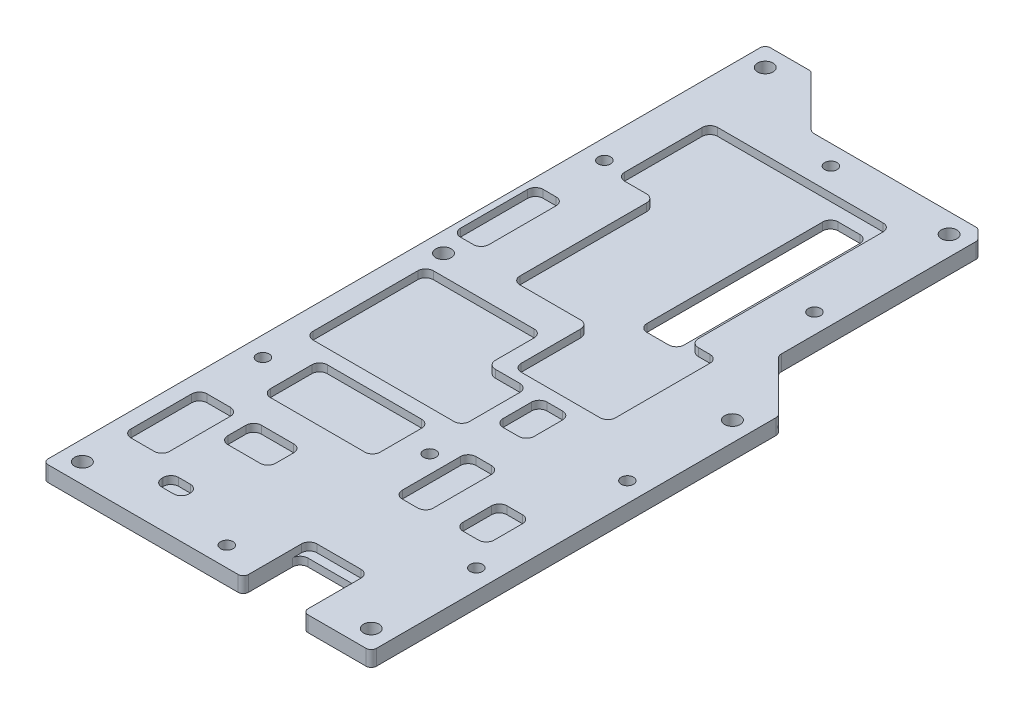
from build123d import *

# Parameters (mm, degrees)
BOSS_EXTRUDE1_DEPTH                                  = 3
CUT_EXTRUDE1_DEPTH                                   = 1.5
CUT_EXTRUDE2_REACH                                   = 155.484
F_3_0MM_DOWEL_HOLE1_D                                = 3
CSK_FOR_M2_COUNTERSUNK_RAISED_HEAD_SCREW_D           = 2.4
CSK_FOR_M2_COUNTERSUNK_RAISED_HEAD_SCREW_CSINK_D     = 4.4
CSK_FOR_M2_COUNTERSUNK_RAISED_HEAD_SCREW_CSINK_ANGLE = 90


with BuildPart() as part:
    # Sketch1 → Boss-Extrude1 (new body)
    with BuildSketch(Plane(origin=(0, 0, 0), x_dir=(1, 0, 0), z_dir=(0, 1, 0))):
        with BuildLine():
            Line((0, 1), (0, 138.7))
            ThreePointArc((0, 138.7), (0.292893219, 139.407106781), (1, 139.7))
            Line((1, 139.7), (8.475786438, 139.7))
            ThreePointArc((8.475786438, 139.7), (8.85846987, 139.623879533), (9.182893219, 139.407106781))
            Line((9.182893219, 139.407106781), (18.610660172, 129.979339828))
            ThreePointArc((18.610660172, 129.979339828), (19.097295195, 129.654180701), (19.671320344, 129.54))
            Line((19.671320344, 129.54), (50.895786438, 129.54))
            ThreePointArc((50.895786438, 129.54), (51.27846987, 129.463879533), (51.602893219, 129.247106781))
            Line((51.602893219, 129.247106781), (53.047106781, 127.802893219))
            ThreePointArc((53.047106781, 127.802893219), (53.263879533, 127.47846987), (53.34, 127.095786438))
            Line((53.34, 127.095786438), (53.34, 89.521320344))
            ThreePointArc((53.34, 89.521320344), (53.454180701, 88.947295195), (53.779339828, 88.460660172))
            Line((53.779339828, 88.460660172), (63.207106781, 79.032893219))
            ThreePointArc((63.207106781, 79.032893219), (63.423879533, 78.70846987), (63.5, 78.325786438))
            Line((63.5, 78.325786438), (63.5, 1))
            ThreePointArc((63.5, 1), (63.207106781, 0.292893219), (62.5, 0))
            Line((62.5, 0), (51.25, 0))
            ThreePointArc((51.25, 0), (50.542893219, 0.292893219), (50.25, 1))
            Line((50.25, 1), (50.25, 9.5))
            ThreePointArc((50.25, 9.5), (49.810660172, 10.560660172), (48.75, 11))
            Line((48.75, 11), (40.25, 11))
            ThreePointArc((40.25, 11), (39.189339828, 10.560660172), (38.75, 9.5))
            Line((38.75, 9.5), (38.75, 1))
            ThreePointArc((38.75, 1), (38.457106781, 0.292893219), (37.75, 0))
            Line((37.75, 0), (1, 0))
            ThreePointArc((1, 0), (0.292893219, 0.292893219), (0, 1))
        make_face()
    extrude(amount=BOSS_EXTRUDE1_DEPTH)

    # Sketch2 → Cut-Extrude1 (cut)
    with BuildSketch(Plane(origin=(0, 3, 0), x_dir=(1, 0, 0), z_dir=(0, 1, 0))):
        with BuildLine():
            Line((50.25, 0), (50.25, 11.25))
            ThreePointArc((50.25, 11.25), (49.810660172, 12.310660172), (48.75, 12.75))
            Line((48.75, 12.75), (40.25, 12.75))
            ThreePointArc((40.25, 12.75), (39.189339828, 12.310660172), (38.75, 11.25))
            Line((38.75, 11.25), (38.75, 0))
            Line((38.75, 0), (50.25, 0))
        make_face()
        with BuildLine():
            Line((52.25, 37.5), (55.25, 37.5))
            ThreePointArc((55.25, 37.5), (56.310660172, 37.060660172), (56.75, 36))
            Line((56.75, 36), (56.75, 30.5))
            ThreePointArc((56.75, 30.5), (56.310660172, 29.439339828), (55.25, 29))
            Line((55.25, 29), (52.25, 29))
            ThreePointArc((52.25, 29), (51.189339828, 29.439339828), (50.75, 30.5))
            Line((50.75, 30.5), (50.75, 36))
            ThreePointArc((50.75, 36), (51.189339828, 37.060660172), (52.25, 37.5))
        make_face()
        with BuildLine():
            Line((41, 42.75), (44, 42.75))
            ThreePointArc((44, 42.75), (45.060660172, 42.310660172), (45.5, 41.25))
            Line((45.5, 41.25), (45.5, 30))
            ThreePointArc((45.5, 30), (45.060660172, 28.939339828), (44, 28.5))
            Line((44, 28.5), (41, 28.5))
            ThreePointArc((41, 28.5), (39.939339828, 28.939339828), (39.5, 30))
            Line((39.5, 30), (39.5, 41.25))
            ThreePointArc((39.5, 41.25), (39.939339828, 42.310660172), (41, 42.75))
        make_face()
        with BuildLine():
            Line((11.25, 43.75), (29.5, 43.75))
            ThreePointArc((29.5, 43.75), (30.560660172, 43.310660172), (31, 42.25))
            Line((31, 42.25), (31, 34.25))
            ThreePointArc((31, 34.25), (30.560660172, 33.189339828), (29.5, 32.75))
            Line((29.5, 32.75), (11.25, 32.75))
            ThreePointArc((11.25, 32.75), (10.189339828, 33.189339828), (9.75, 34.25))
            Line((9.75, 34.25), (9.75, 42.25))
            ThreePointArc((9.75, 42.25), (10.189339828, 43.310660172), (11.25, 43.75))
        make_face()
        with BuildLine():
            Line((18, 10.5), (15.75, 10.5))
            ThreePointArc((15.75, 10.5), (14.689339828, 10.060660172), (14.25, 9))
            Line((14.25, 9), (14.25, 8.75))
            ThreePointArc((14.25, 8.75), (14.689339828, 7.689339828), (15.75, 7.25))
            Line((15.75, 7.25), (18, 7.25))
            ThreePointArc((18, 7.25), (19.060660172, 7.689339828), (19.5, 8.75))
            Line((19.5, 8.75), (19.5, 9))
            ThreePointArc((19.5, 9), (19.060660172, 10.060660172), (18, 10.5))
        make_face()
        with BuildLine():
            Line((4.25, 68.25), (4.25, 48))
            ThreePointArc((4.25, 48), (4.689339828, 46.939339828), (5.75, 46.5))
            Line((5.75, 46.5), (33, 46.5))
            ThreePointArc((33, 46.5), (34.060660172, 46.939339828), (34.5, 48))
            Line((34.5, 48), (34.5, 57.75))
            ThreePointArc((34.5, 57.75), (34.060660172, 58.810660172), (33, 59.25))
            Line((33, 59.25), (28.25, 59.25))
            ThreePointArc((28.25, 59.25), (27.189339828, 59.689339828), (26.75, 60.75))
            Line((26.75, 60.75), (26.75, 68.25))
            ThreePointArc((26.75, 68.25), (26.310660172, 69.310660172), (25.25, 69.75))
            Line((25.25, 69.75), (5.75, 69.75))
            ThreePointArc((5.75, 69.75), (4.689339828, 69.310660172), (4.25, 68.25))
        make_face()
        with BuildLine():
            Line((4.5, 27.25), (9, 27.25))
            ThreePointArc((9, 27.25), (10.060660172, 26.810660172), (10.5, 25.75))
            Line((10.5, 25.75), (10.5, 14))
            ThreePointArc((10.5, 14), (10.060660172, 12.939339828), (9, 12.5))
            Line((9, 12.5), (4.5, 12.5))
            ThreePointArc((4.5, 12.5), (3.439339828, 12.939339828), (3, 14))
            Line((3, 14), (3, 25.75))
            ThreePointArc((3, 25.75), (3.439339828, 26.810660172), (4.5, 27.25))
        make_face()
        with BuildLine():
            Line((15, 27.25), (21.25, 27.25))
            ThreePointArc((21.25, 27.25), (22.310660172, 26.810660172), (22.75, 25.75))
            Line((22.75, 25.75), (22.75, 22.25))
            ThreePointArc((22.75, 22.25), (22.310660172, 21.189339828), (21.25, 20.75))
            Line((21.25, 20.75), (15, 20.75))
            ThreePointArc((15, 20.75), (13.939339828, 21.189339828), (13.5, 22.25))
            Line((13.5, 22.25), (13.5, 25.75))
            ThreePointArc((13.5, 25.75), (13.939339828, 26.810660172), (15, 27.25))
        make_face()
        with BuildLine():
            Line((31.25, 61.25), (46.5, 61.25))
            ThreePointArc((46.5, 61.25), (47.560660172, 61.689339828), (48, 62.75))
            Line((48, 62.75), (48, 81))
            ThreePointArc((48, 81), (47.560660172, 82.060660172), (46.5, 82.5))
            Line((46.5, 82.5), (44.25, 82.5))
            ThreePointArc((44.25, 82.5), (43.189339828, 82.939339828), (42.75, 84))
            Line((42.75, 84), (42.75, 119.75))
            ThreePointArc((42.75, 119.75), (42.310660172, 120.810660172), (41.25, 121.25))
            Line((41.25, 121.25), (9.25, 121.25))
            ThreePointArc((9.25, 121.25), (8.189339828, 120.810660172), (7.75, 119.75))
            Line((7.75, 119.75), (7.75, 104.75))
            ThreePointArc((7.75, 104.75), (8.189339828, 103.689339828), (9.25, 103.25))
            Line((9.25, 103.25), (13.5, 103.25))
            ThreePointArc((13.5, 103.25), (14.560660172, 102.810660172), (15, 101.75))
            Line((15, 101.75), (15, 77.25))
            ThreePointArc((15, 77.25), (15.439339828, 76.189339828), (16.5, 75.75))
            Line((16.5, 75.75), (28.25, 75.75))
            ThreePointArc((28.25, 75.75), (29.310660172, 75.310660172), (29.75, 74.25))
            Line((29.75, 74.25), (29.75, 62.75))
            ThreePointArc((29.75, 62.75), (30.189339828, 61.689339828), (31.25, 61.25))
        make_face()
        with BuildLine():
            Line((38.75, 58.75), (41.75, 58.75))
            ThreePointArc((41.75, 58.75), (42.810660172, 58.310660172), (43.25, 57.25))
            Line((43.25, 57.25), (43.25, 51.75))
            ThreePointArc((43.25, 51.75), (42.810660172, 50.689339828), (41.75, 50.25))
            Line((41.75, 50.25), (38.75, 50.25))
            ThreePointArc((38.75, 50.25), (37.689339828, 50.689339828), (37.25, 51.75))
            Line((37.25, 51.75), (37.25, 57.25))
            ThreePointArc((37.25, 57.25), (37.689339828, 58.310660172), (38.75, 58.75))
        make_face()
        with BuildLine():
            Line((2.75, 94), (5.25, 94))
            ThreePointArc((5.25, 94), (6.310660172, 93.560660172), (6.75, 92.5))
            Line((6.75, 92.5), (6.75, 79.5))
            ThreePointArc((6.75, 79.5), (6.310660172, 78.439339828), (5.25, 78))
            Line((5.25, 78), (2.75, 78))
            ThreePointArc((2.75, 78), (1.689339828, 78.439339828), (1.25, 79.5))
            Line((1.25, 79.5), (1.25, 92.5))
            ThreePointArc((1.25, 92.5), (1.689339828, 93.560660172), (2.75, 94))
        make_face()
    extrude(amount=-CUT_EXTRUDE1_DEPTH, mode=Mode.SUBTRACT)

    # Sketch3 → Cut-Extrude2 (cut, up to next)
    with BuildSketch(Plane(origin=(0, 0, 0), x_dir=(-1, 0, 0), z_dir=(0, -1, 0)), mode=Mode.PRIVATE) as cut_extrude2_sk1:
        with BuildLine():
            Line((-39.44, 118.58), (-35.24, 118.58))
            ThreePointArc((-35.24, 118.58), (-34.179339828, 118.140660172), (-33.74, 117.08))
            Line((-33.74, 117.08), (-33.74, 83.08))
            ThreePointArc((-33.74, 83.08), (-34.179339828, 82.019339828), (-35.24, 81.58))
            Line((-35.24, 81.58), (-39.44, 81.58))
            ThreePointArc((-39.44, 81.58), (-40.500660172, 82.019339828), (-40.94, 83.08))
            Line((-40.94, 83.08), (-40.94, 117.08))
            ThreePointArc((-40.94, 117.08), (-40.500660172, 118.140660172), (-39.44, 118.58))
        make_face()
    cut_extrude2_tool1 = extrude(cut_extrude2_sk1.sketch, amount=-CUT_EXTRUDE2_REACH, mode=Mode.PRIVATE) & part.part
    add(cut_extrude2_tool1.solids().sort_by_distance((37.34, 0, -100.08))[0], mode=Mode.SUBTRACT)

    # Ø3.0mm Dowel Hole1 (through all)
    with Locations(Plane(origin=(0, 3, 0), x_dir=(1, 0, 0), z_dir=(0, 1, 0))):
        with Locations((3.81, 135.89), (49.53, 125.73), (59.69, 73.66), (59.69, 3.81), (3.81, 3.81), (3.81, 73.66)):
            Hole(F_3_0MM_DOWEL_HOLE1_D / 2)

    # CSK for M2 Countersunk Raised Head Screw1 (through all)
    with Locations(Plane(origin=(0, 0, 0), x_dir=(-1, 0, 0), z_dir=(0, -1, 0))):
        with Locations((-26.67, 125.73), (-31.75, 3.81), (-59.69, 53.34), (-3.81, 38.74), (-36.07, 38.74), (-59.69, 24.13), (-49.53, 99.69), (-3.81, 104.77)):
            CounterSinkHole(CSK_FOR_M2_COUNTERSUNK_RAISED_HEAD_SCREW_D / 2, CSK_FOR_M2_COUNTERSUNK_RAISED_HEAD_SCREW_CSINK_D / 2, counter_sink_angle=CSK_FOR_M2_COUNTERSUNK_RAISED_HEAD_SCREW_CSINK_ANGLE)


solid = part.part
